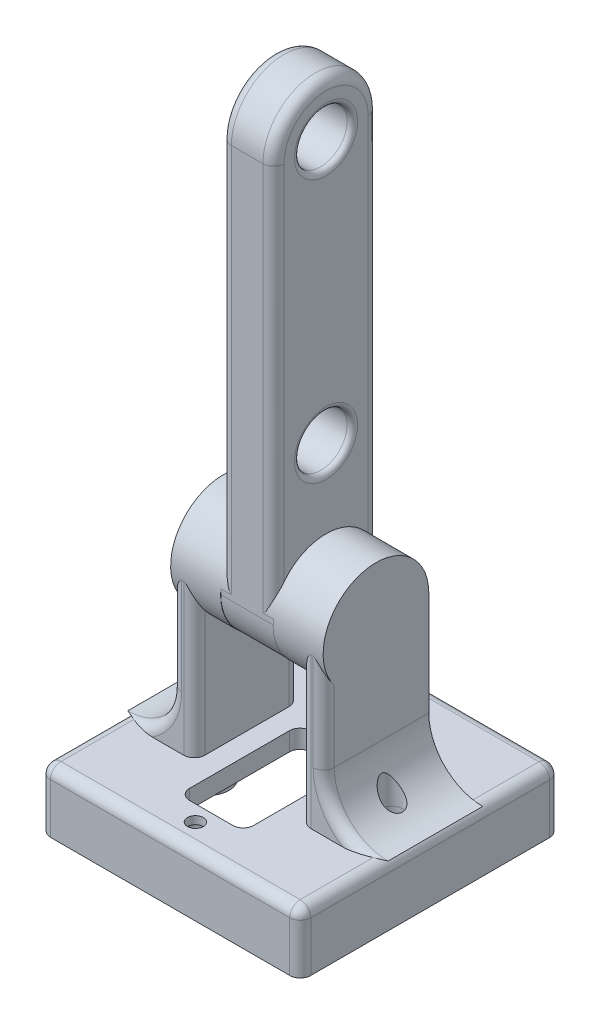
from build123d import *

# Parameters (mm, degrees)
CROQUIS1_W              = 49.5
CROQUIS1_H              = 49.4
CROQUIS1_R              = 2
CROQUIS1_R_2            = 1.5
CROQUIS1_W_2            = 12.2
CROQUIS1_H_2            = 23
SALIENTE_EXTRUIR1_DEPTH = 3.5
CORTAR_EXTRUIR1_START   = -2
CROQUIS2_R              = 2.3
CROQUIS2_R_2            = 1.5
CORTAR_EXTRUIR1_DEPTH   = 2
CROQUIS7_W              = 49.5
CROQUIS7_H              = 49.4
CROQUIS7_R              = 2
SALIENTE_EXTRUIR6_DEPTH = 8
REDONDEO6_R             = 2
REDONDEO7_R             = 2
CROQUIS3_R              = 5
SALIENTE_EXTRUIR2_DEPTH = 5
SALIENTE_EXTRUIR4_DEPTH = 20
CORTAR_EXTRUIR2_START   = 10
CROQUIS4_R              = 2
CORTAR_EXTRUIR2_DEPTH   = 10
CROQUIS6_R              = 10.05
SALIENTE_EXTRUIR5_DEPTH = 9.5
REDONDEO4_R             = 1
REDONDEO5_R             = 2


with BuildPart() as part:
    # Croquis1 → Saliente-Extruir1 (new body)
    with BuildSketch(Plane(origin=(0, 0, 0), x_dir=(1, 0, 0), z_dir=(0, 1, 0))):
        with Locations((0, 5.4)):
            Rectangle(CROQUIS1_W, CROQUIS1_H)
        with Locations(Location((-17.5, 5.4, 0), (0, 0, 270))):
            Circle(CROQUIS1_R, mode=Mode.SUBTRACT)
        with Locations(Location((17.5, 5.4, 0), (0, 0, 270))):
            Circle(CROQUIS1_R, mode=Mode.SUBTRACT)
        with Locations(Location((0, 14.5, 0), (0, 0, 270))):
            Circle(CROQUIS1_R_2, mode=Mode.SUBTRACT)
        with Locations(Location((0, -14.5, 0), (0, 0, 270))):
            Circle(CROQUIS1_R_2, mode=Mode.SUBTRACT)
        Rectangle(CROQUIS1_W_2, CROQUIS1_H_2, mode=Mode.SUBTRACT)
    extrude(amount=-SALIENTE_EXTRUIR1_DEPTH)

    # Croquis2 → Cortar-Extruir1 (cut)
    # profile 1 of 2: a face of its own
    with BuildSketch(Plane.XZ.offset(3.5).offset(CORTAR_EXTRUIR1_START)):
        with Locations(Location((0, -14.5, 0), (0, 0, 270))):
            Circle(CROQUIS2_R)
        with Locations(Location((0, -14.5, 0), (0, 0, 90))):
            Circle(CROQUIS2_R_2, mode=Mode.SUBTRACT)
    # profile 2 of 2: a face of its own
    with BuildSketch(Plane.XZ.offset(3.5).offset(CORTAR_EXTRUIR1_START)):
        with Locations(Location((0, 14.5, 0), (0, 0, 270))):
            Circle(CROQUIS2_R)
        with Locations(Location((0, 14.5, 0), (0, 0, 90))):
            Circle(CROQUIS2_R_2, mode=Mode.SUBTRACT)
    extrude(amount=CORTAR_EXTRUIR1_DEPTH, mode=Mode.SUBTRACT)

    # Croquis7 → Saliente-Extruir6 (add)
    # profile 1 of 4: a face of its own
    with BuildSketch(Plane.XZ.offset(3.5)):
        with Locations((0, -5.4)):
            Rectangle(CROQUIS7_W, CROQUIS7_H)
        with BuildLine():
            Line((2.137171027, 15.35), (20.75, 15.35))
            Line((20.75, 15.35), (20.75, -1.4))
            Line((20.75, -1.4), (20.75, -9.4))
            Line((20.75, -9.4), (20.75, -26.15))
            Line((20.75, -26.15), (-20.75, -26.15))
            Line((-20.75, -26.15), (-20.75, -9.4))
            Line((-20.75, -9.4), (-20.75, -1.4))
            Line((-20.75, -1.4), (-20.75, 15.35))
            Line((-20.75, 15.35), (-2.137171027, 15.35))
            ThreePointArc((-2.137171027, 15.35), (0, 16.8), (2.137171027, 15.35))
        make_face(mode=Mode.SUBTRACT)
    # profile 2 of 4: a face of its own
    with BuildSketch(Plane.XZ.offset(3.5)):
        with Locations((0, -5.4)):
            Rectangle(CROQUIS7_W, CROQUIS7_H)
        with BuildLine():
            Line((2.137171027, 15.35), (20.75, 15.35))
            Line((20.75, 15.35), (20.75, -1.4))
            Line((20.75, -1.4), (20.75, -9.4))
            Line((20.75, -9.4), (20.75, -26.15))
            Line((20.75, -26.15), (-20.75, -26.15))
            Line((-20.75, -26.15), (-20.75, -9.4))
            Line((-20.75, -9.4), (-20.75, -1.4))
            Line((-20.75, -1.4), (-20.75, 15.35))
            Line((-20.75, 15.35), (-2.137171027, 15.35))
            ThreePointArc((-2.137171027, 15.35), (0, 16.8), (2.137171027, 15.35))
        make_face(mode=Mode.SUBTRACT)
    # profile 3 of 4: a face of its own
    with BuildSketch(Plane.XZ.offset(3.5)):
        with BuildLine():
            Line((-17.5, -1.4), (-20.75, -1.4))
            Line((-20.75, -1.4), (-20.75, -9.4))
            Line((-20.75, -9.4), (-17.5, -9.4))
            ThreePointArc((-17.5, -9.4), (-13.5, -5.4), (-17.5, -1.4))
        make_face()
        with Locations(Location((-17.5, -5.4, 0), (0, 0, 90))):
            Circle(CROQUIS7_R, mode=Mode.SUBTRACT)
    # profile 4 of 4: a face of its own
    with BuildSketch(Plane.XZ.offset(3.5)):
        with BuildLine():
            Line((20.75, -9.4), (20.75, -1.4))
            Line((20.75, -1.4), (17.5, -1.4))
            ThreePointArc((17.5, -1.4), (13.5, -5.4), (17.5, -9.4))
            Line((17.5, -9.4), (20.75, -9.4))
        make_face()
        with Locations(Location((17.5, -5.4, 0), (0, 0, 90))):
            Circle(CROQUIS7_R, mode=Mode.SUBTRACT)
    extrude(amount=SALIENTE_EXTRUIR6_DEPTH)

    # Redondeo6
    redondeo6_edges = [part.edges().sort_by_distance(p)[0] for p in [
        (20.75, -7.5, -9.4),
        (20.75, -7.5, -26.15),
        (-20.75, -7.5, -26.15),
        (-20.75, -7.5, -9.4),
        (-20.75, -7.5, -1.4),
        (-20.75, -7.5, 15.35),
        (-2.137171027, -7.5, 15.35),
        (2.137171027, -7.5, 15.35),
        (20.75, -7.5, 15.35),
        (20.75, -7.5, -1.4),
    ]]
    fillet(redondeo6_edges, radius=REDONDEO6_R)

    # Redondeo7
    redondeo7_edges = [part.edges().sort_by_distance(p)[0] for p in [
        (-24.75, 0, -5.4),
        (0, 0, -30.1),
        (24.75, 0, -5.4),
        (0, 0, 19.3),
        (-24.75, -5.75, 19.3),
        (-24.75, -5.75, -30.1),
        (24.75, -5.75, -30.1),
        (24.75, -5.75, 19.3),
        (6.1, -1.75, -11.5),
        (-6.1, -1.75, -11.5),
        (-6.1, -1.75, 11.5),
        (6.1, -1.75, 11.5),
    ]]
    fillet(redondeo7_edges, radius=REDONDEO7_R)


with BuildPart() as body_2:
    # Croquis3 → Saliente-Extruir2 (new, symmetric)
    with BuildSketch(Plane(origin=(0, 0, 0), x_dir=(0, 0, -1), z_dir=(1, 0, 0))):
        with BuildLine():
            Line((-4.65, 105), (-4.65, 30))
            ThreePointArc((-4.65, 30), (5.35, 20), (15.35, 30))
            Line((15.35, 30), (15.35, 105))
            ThreePointArc((15.35, 105), (5.35, 115), (-4.65, 105))
        make_face()
        with Locations((5.35, 55)):
            Circle(CROQUIS3_R, mode=Mode.SUBTRACT)
        with Locations((5.35, 105)):
            Circle(CROQUIS3_R, mode=Mode.SUBTRACT)
    extrude(amount=SALIENTE_EXTRUIR2_DEPTH, both=True)

    # Redondeo4
    redondeo4_edges = [body_2.edges().sort_by_distance(p)[0] for p in [
        (5, 55, -0.35),
        (5, 105, -0.35),
        (-5, 105, -0.35),
        (-5, 55, -0.35),
    ]]
    fillet(redondeo4_edges, radius=REDONDEO4_R)


with BuildPart() as body_3:
    # Croquis5 → Saliente-Extruir4 (new body)
    with BuildSketch(Plane.XY.offset(4.6)):
        Polygon((10.1, 30), (10.1, 0), (14.5, 0), (14.5, 10.25), (14.5, 30), align=None)
        with BuildLine():
            Line((14.5, 10.25), (14.5, 0))
            Line((14.5, 0), (24.75, 0))
            ThreePointArc((24.75, 0), (17.502155493, 3.002155493), (14.5, 10.25))
        make_face()
    extrude(amount=-SALIENTE_EXTRUIR4_DEPTH)

    # Croquis4 → Cortar-Extruir2 (cut)
    with BuildSketch(Plane(origin=(0, 0, 0), x_dir=(1, 0, 0), z_dir=(0, 1, 0)).offset(CORTAR_EXTRUIR2_START)):
        with Locations(Location((17.5, 5.4, 0), (0, 0, 270))):
            Circle(CROQUIS4_R)
    extrude(amount=-CORTAR_EXTRUIR2_DEPTH, mode=Mode.SUBTRACT)

    # Croquis6 → Saliente-Extruir5 (add)
    with BuildSketch(Plane(origin=(14.5, 0, 0), x_dir=(0, 0, -1), z_dir=(1, 0, 0))):
        with Locations((5.35, 30)):
            Circle(CROQUIS6_R)
    extrude(amount=-SALIENTE_EXTRUIR5_DEPTH)


with BuildPart() as body_4:
    # Simetría3: mirrored copy
    add(body_3.part.mirror(Plane(origin=(0, 0, 0), x_dir=(0, 0, 1), z_dir=(1, 0, 0))))


with BuildPart() as body_2_1:
    add(body_2.part)

    # Combinar2: union body 4, body 3
    add(body_4.part)
    add(body_3.part)

    # Redondeo5
    # the kernel refuses this fillet: 2 mm, written as the material it takes off along each edge
    with BuildSketch(Plane(origin=(-5, 105, -5.35), x_dir=(0, 0, -1), z_dir=(0, -1, 0))) as redondeo5_piece_1:
        with BuildLine():
            CenterArc((10 - REDONDEO5_R, REDONDEO5_R), REDONDEO5_R, 270, 90)
            Line((10 - REDONDEO5_R, 0), (10, 0))
            Line((10, 0), (10, REDONDEO5_R))
        make_face()
    revolve(axis=Axis((-5, 105, -5.35), (1, 0, 0)), revolution_arc=180, mode=Mode.SUBTRACT)
    with BuildSketch(Plane(origin=(-5, 26.00124922, -15.35), x_dir=(1, 0, 0), z_dir=(0, 1, 0))) as redondeo5_piece_2_section:
        with BuildLine():
            CenterArc((REDONDEO5_R, -REDONDEO5_R), REDONDEO5_R, 90, 90)
            Line((0, -REDONDEO5_R), (0, 0))
            Line((0, 0), (REDONDEO5_R, 0))
        make_face()
    redondeo5_piece_2 = extrude(amount=78.99875078, mode=Mode.PRIVATE)
    redondeo5_piece_2 = redondeo5_piece_2 - Plane(origin=(-4.545274838, 30, -5.35), x_dir=(0, 0, -1), z_dir=(-1, 0, 0)) * Cylinder(10.05, 166, mode=Mode.PRIVATE)
    add(redondeo5_piece_2, mode=Mode.SUBTRACT)
    with BuildSketch(Plane(origin=(5, 105, -5.35), x_dir=(0, 0, -1), z_dir=(0, -1, 0))) as redondeo5_piece_3:
        with BuildLine():
            CenterArc((10 - REDONDEO5_R, -REDONDEO5_R), REDONDEO5_R, 0, 90)
            Line((10, -REDONDEO5_R), (10, 0))
            Line((10, 0), (10 - REDONDEO5_R, 0))
        make_face()
    revolve(axis=Axis((5, 105, -5.35), (1, 0, 0)), revolution_arc=180, mode=Mode.SUBTRACT)
    with BuildSketch(Plane(origin=(5, 105, 4.65), x_dir=(0, 0, -1), z_dir=(0, -1, 0))) as redondeo5_piece_4_section:
        with BuildLine():
            CenterArc((REDONDEO5_R, -REDONDEO5_R), REDONDEO5_R, 90, 90)
            Line((0, -REDONDEO5_R), (0, 0))
            Line((0, 0), (REDONDEO5_R, 0))
        make_face()
    redondeo5_piece_4 = extrude(amount=78.99875078, mode=Mode.PRIVATE)
    redondeo5_piece_4 = redondeo5_piece_4 - Plane(origin=(4.663276769, 30, -5.35), x_dir=(0, 0, -1), z_dir=(1, 0, 0)) * Cylinder(10.05, 166, mode=Mode.PRIVATE)
    add(redondeo5_piece_4, mode=Mode.SUBTRACT)
    with BuildSketch(Plane(origin=(-24.75, 10.25, 4.6), x_dir=(-0.46886101836219096, -0.8832719544174203, 0), z_dir=(-0.8832719544174203, 0.46886101836219096, 0))) as redondeo5_piece_5:
        with BuildLine():
            CenterArc((10.25 + REDONDEO5_R, -REDONDEO5_R), REDONDEO5_R, 90, 90)
            Line((10.25, -REDONDEO5_R), (10.25, 0))
            Line((10.25, 0), (10.25 + REDONDEO5_R, 0))
        make_face()
    revolve(axis=Axis((-24.75, 10.25, 4.6), (0, 0, 1)), revolution_arc=117.960388144, mode=Mode.SUBTRACT)
    with BuildSketch(Plane(origin=(-10.1, 35, -15.4), x_dir=(0, 0, 1), z_dir=(0, -1, 0))) as redondeo5_piece_6_section:
        with BuildLine():
            CenterArc((REDONDEO5_R, REDONDEO5_R), REDONDEO5_R, 180, 90)
            Line((0, REDONDEO5_R), (0, 0))
            Line((0, 0), (REDONDEO5_R, 0))
        make_face()
    redondeo5_piece_6 = extrude(amount=40, mode=Mode.PRIVATE)
    redondeo5_piece_6 = redondeo5_piece_6 - Plane(origin=(-10.557444567, 30, -5.35), x_dir=(0, 0, -1), z_dir=(-1, 0, 0)) * Cylinder(10.05, 88, mode=Mode.PRIVATE)
    add(redondeo5_piece_6, mode=Mode.SUBTRACT)
    with BuildSketch(Plane(origin=(-14.5, 33.585786438, 4.6), x_dir=(0, 0, -1), z_dir=(0, -1, 0))) as redondeo5_piece_7_section:
        with BuildLine():
            CenterArc((REDONDEO5_R, REDONDEO5_R), REDONDEO5_R, 180, 90)
            Line((0, REDONDEO5_R), (0, 0))
            Line((0, 0), (REDONDEO5_R, 0))
        make_face()
    redondeo5_piece_7 = extrude(amount=23.335786438, mode=Mode.PRIVATE)
    redondeo5_piece_7 = redondeo5_piece_7 - Plane(origin=(-14.038620532, 30, -5.35), x_dir=(0, 0, -1), z_dir=(-1, 0, 0)) * Cylinder(10.05, 55, mode=Mode.PRIVATE)
    add(redondeo5_piece_7, mode=Mode.SUBTRACT)
    with BuildSketch(Plane(origin=(-10.1, 33.585786438, 4.6), x_dir=(-1, 0, 0), z_dir=(0, -1, 0))) as redondeo5_piece_8_section:
        with BuildLine():
            CenterArc((REDONDEO5_R, REDONDEO5_R), REDONDEO5_R, 180, 90)
            Line((0, REDONDEO5_R), (0, 0))
            Line((0, 0), (REDONDEO5_R, 0))
        make_face()
    redondeo5_piece_8 = extrude(amount=38.585786438, mode=Mode.PRIVATE)
    redondeo5_piece_8 = redondeo5_piece_8 - Plane(origin=(-10.555805326, 30, -5.35), x_dir=(0, 0, -1), z_dir=(-1, 0, 0)) * Cylinder(10.05, 86, mode=Mode.PRIVATE)
    add(redondeo5_piece_8, mode=Mode.SUBTRACT)
    with BuildSketch(Plane(origin=(10.1, 33.585786438, 4.6), x_dir=(1, 0, 0), z_dir=(0, -1, 0))) as redondeo5_piece_9_section:
        with BuildLine():
            CenterArc((REDONDEO5_R, -REDONDEO5_R), REDONDEO5_R, 90, 90)
            Line((0, -REDONDEO5_R), (0, 0))
            Line((0, 0), (REDONDEO5_R, 0))
        make_face()
    redondeo5_piece_9 = extrude(amount=38.585786438, mode=Mode.PRIVATE)
    redondeo5_piece_9 = redondeo5_piece_9 - Plane(origin=(10.555805326, 30, -5.35), x_dir=(0, 0, -1), z_dir=(1, 0, 0)) * Cylinder(10.05, 86, mode=Mode.PRIVATE)
    add(redondeo5_piece_9, mode=Mode.SUBTRACT)
    with BuildSketch(Plane(origin=(10.1, 35, -15.4), x_dir=(0, 0, 1), z_dir=(0, -1, 0))) as redondeo5_piece_10_section:
        with BuildLine():
            CenterArc((REDONDEO5_R, -REDONDEO5_R), REDONDEO5_R, 90, 90)
            Line((0, -REDONDEO5_R), (0, 0))
            Line((0, 0), (REDONDEO5_R, 0))
        make_face()
    redondeo5_piece_10 = extrude(amount=40, mode=Mode.PRIVATE)
    redondeo5_piece_10 = redondeo5_piece_10 - Plane(origin=(10.557444567, 30, -5.35), x_dir=(0, 0, -1), z_dir=(1, 0, 0)) * Cylinder(10.05, 88, mode=Mode.PRIVATE)
    add(redondeo5_piece_10, mode=Mode.SUBTRACT)
    with BuildSketch(Plane(origin=(24.75, 10.25, 4.6), x_dir=(0.46886101836219096, -0.8832719544174203, 0), z_dir=(0.8832719544174203, 0.46886101836219096, 0))) as redondeo5_piece_11:
        with BuildLine():
            CenterArc((10.25 + REDONDEO5_R, REDONDEO5_R), REDONDEO5_R, 180, 90)
            Line((10.25, REDONDEO5_R), (10.25, 0))
            Line((10.25, 0), (10.25 + REDONDEO5_R, 0))
        make_face()
    revolve(axis=Axis((24.75, 10.25, 4.6), (0, 0, -1)), revolution_arc=117.960388144, mode=Mode.SUBTRACT)
    with BuildSketch(Plane(origin=(14.5, 33.585786438, 4.6), x_dir=(0, 0, -1), z_dir=(0, -1, 0))) as redondeo5_piece_12_section:
        with BuildLine():
            CenterArc((REDONDEO5_R, -REDONDEO5_R), REDONDEO5_R, 90, 90)
            Line((0, -REDONDEO5_R), (0, 0))
            Line((0, 0), (REDONDEO5_R, 0))
        make_face()
    redondeo5_piece_12 = extrude(amount=23.335786438, mode=Mode.PRIVATE)
    redondeo5_piece_12 = redondeo5_piece_12 - Plane(origin=(14.038620532, 30, -5.35), x_dir=(0, 0, -1), z_dir=(1, 0, 0)) * Cylinder(10.05, 55, mode=Mode.PRIVATE)
    add(redondeo5_piece_12, mode=Mode.SUBTRACT)
    with BuildSketch(Plane(origin=(5, 26.00124922, -15.35), x_dir=(0, 0, 1), z_dir=(0, 1, 0))) as redondeo5_piece_13_section:
        with BuildLine():
            CenterArc((REDONDEO5_R, -REDONDEO5_R), REDONDEO5_R, 90, 90)
            Line((0, -REDONDEO5_R), (0, 0))
            Line((0, 0), (REDONDEO5_R, 0))
        make_face()
    redondeo5_piece_13 = extrude(amount=78.99875078, mode=Mode.PRIVATE)
    redondeo5_piece_13 = redondeo5_piece_13 - Plane(origin=(4.545276311, 30, -5.35), x_dir=(0, 0, -1), z_dir=(1, 0, 0)) * Cylinder(10.05, 166, mode=Mode.PRIVATE)
    add(redondeo5_piece_13, mode=Mode.SUBTRACT)
    with BuildSketch(Plane(origin=(-5, 105, 4.65), x_dir=(1, 0, 0), z_dir=(0, -1, 0))) as redondeo5_piece_14_section:
        with BuildLine():
            CenterArc((REDONDEO5_R, -REDONDEO5_R), REDONDEO5_R, 90, 90)
            Line((0, -REDONDEO5_R), (0, 0))
            Line((0, 0), (REDONDEO5_R, 0))
        make_face()
    redondeo5_piece_14 = extrude(amount=78.99875078, mode=Mode.PRIVATE)
    redondeo5_piece_14 = redondeo5_piece_14 - Plane(origin=(-4.545255989, 30, -5.35), x_dir=(0, 0, -1), z_dir=(-1, 0, 0)) * Cylinder(10.05, 166, mode=Mode.PRIVATE)
    add(redondeo5_piece_14, mode=Mode.SUBTRACT)


solid = Compound([part.part, body_2_1.part])
